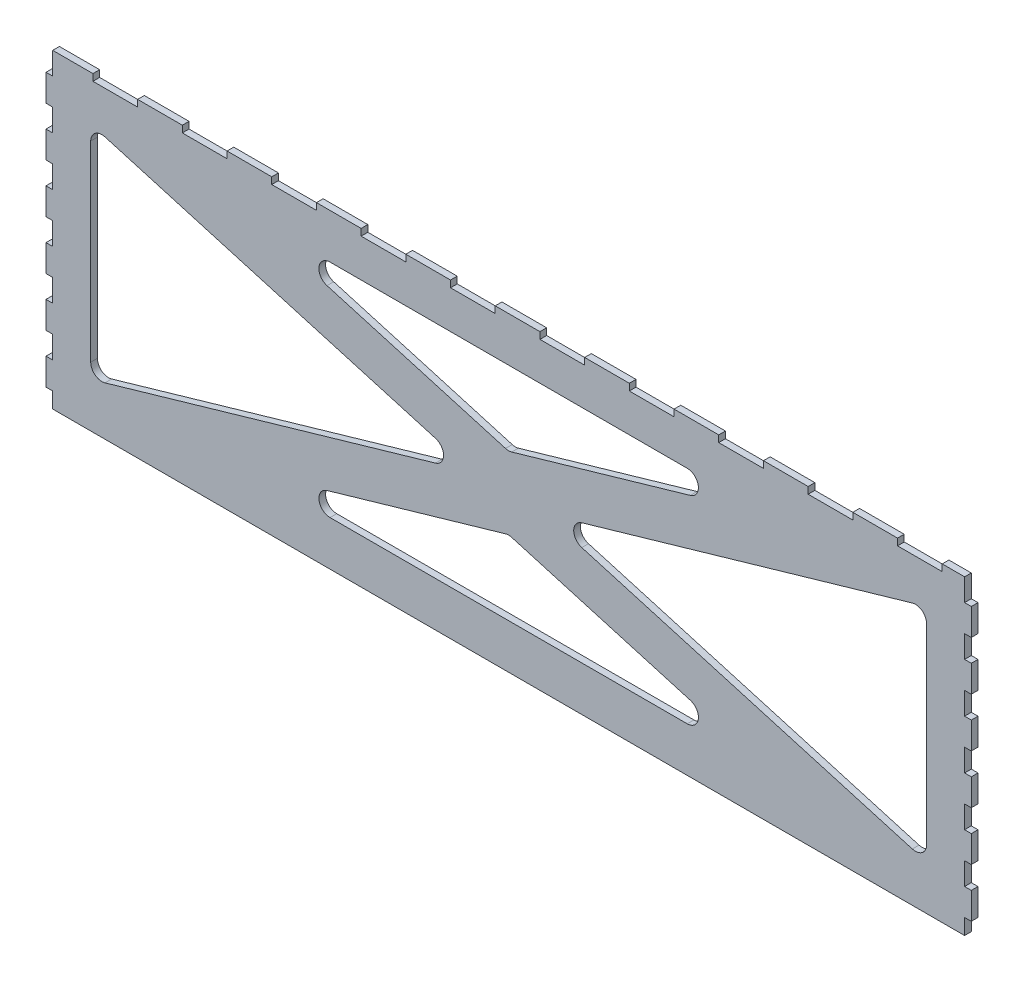
from build123d import *

# Parameters (mm, degrees)
SKETCH1_W           = 414
SKETCH1_H           = 139
BOSS_EXTRUDE1_DEPTH = 3
SKETCH3_W           = 20
SKETCH3_H           = 3
CUT_EXTRUDE2_DEPTH  = 3
SKETCH4_W           = 3
SKETCH4_H           = 12
CUT_EXTRUDE3_DEPTH  = 3


with BuildPart() as part:
    # Sketch1 → Boss-Extrude1 (new body)
    with BuildSketch(Plane.XY.offset(152)):
        Rectangle(SKETCH1_W, SKETCH1_H)
        with BuildLine():
            Line((-187, -42.845788224), (-187, 42.845788224))
            ThreePointArc((-187, 42.845788224), (-185.003590092, 46.843093136), (-180.608621376, 47.648294395))
            Line((-180.608621376, 47.648294395), (-32.721368552, 4.802506171))
            ThreePointArc((-32.721368552, 4.802506171), (-29.112747176, 0), (-32.721368552, -4.802506171))
            Line((-32.721368552, -4.802506171), (-180.608621376, -47.648294395))
            ThreePointArc((-180.608621376, -47.648294395), (-185.003590092, -46.843093136), (-187, -42.845788224))
        make_face(mode=Mode.SUBTRACT)
        with BuildLine():
            Line((79.902960936, 49.5), (-79.902960936, 49.5))
            ThreePointArc((-79.902960936, 49.5), (-84.853341268, 45.202662488), (-81.29433956, 39.697493829))
            Line((-81.29433956, 39.697493829), (-1.391378624, 16.548065617))
            ThreePointArc((-1.391378624, 16.548065617), (0, 16.350571788), (1.391378624, 16.548065617))
            Line((1.391378624, 16.548065617), (81.29433956, 39.697493829))
            ThreePointArc((81.29433956, 39.697493829), (84.853341268, 45.202662488), (79.902960936, 49.5))
        make_face(mode=Mode.SUBTRACT)
        with BuildLine():
            Line((180.608621376, 47.648294395), (32.721368552, 4.802506171))
            ThreePointArc((32.721368552, 4.802506171), (29.112747176, 0), (32.721368552, -4.802506171))
            Line((32.721368552, -4.802506171), (180.608621376, -47.648294395))
            ThreePointArc((180.608621376, -47.648294395), (185.003590092, -46.843093136), (187, -42.845788224))
            Line((187, -42.845788224), (187, 42.845788224))
            ThreePointArc((187, 42.845788224), (185.003590092, 46.843093136), (180.608621376, 47.648294395))
        make_face(mode=Mode.SUBTRACT)
        with BuildLine():
            Line((-81.29433956, -39.697493829), (-1.391378624, -16.548065617))
            ThreePointArc((-1.391378624, -16.548065617), (0, -16.350571788), (1.391378624, -16.548065617))
            Line((1.391378624, -16.548065617), (81.29433956, -39.697493829))
            ThreePointArc((81.29433956, -39.697493829), (84.853341268, -45.202662488), (79.902960936, -49.5))
            Line((79.902960936, -49.5), (-79.902960936, -49.5))
            ThreePointArc((-79.902960936, -49.5), (-84.853341268, -45.202662488), (-81.29433956, -39.697493829))
        make_face(mode=Mode.SUBTRACT)
    extrude(amount=BOSS_EXTRUDE1_DEPTH)

    # Sketch3 → Cut-Extrude2 (cut)
    with BuildSketch(Plane(origin=(0, 0, 152), x_dir=(-1, 0, 0), z_dir=(0, 0, -1))):
        with Locations((-184, 68)):
            Rectangle(SKETCH3_W, SKETCH3_H)
        with Locations((-144, 68)):
            Rectangle(SKETCH3_W, SKETCH3_H)
        with Locations((-104, 68)):
            Rectangle(SKETCH3_W, SKETCH3_H)
        with Locations((-64, 68)):
            Rectangle(SKETCH3_W, SKETCH3_H)
        with Locations((-24, 68)):
            Rectangle(SKETCH3_W, SKETCH3_H)
        with Locations((16, 68)):
            Rectangle(SKETCH3_W, SKETCH3_H)
        with Locations((56, 68)):
            Rectangle(SKETCH3_W, SKETCH3_H)
        with Locations((96, 68)):
            Rectangle(SKETCH3_W, SKETCH3_H)
        with Locations((136, 68)):
            Rectangle(SKETCH3_W, SKETCH3_H)
        with Locations((176, 68)):
            Rectangle(SKETCH3_W, SKETCH3_H)
    extrude(amount=-CUT_EXTRUDE2_DEPTH, mode=Mode.SUBTRACT)

    # Sketch4 → Cut-Extrude3 (cut)
    with BuildSketch(Plane.ZY.offset(207)):
        with BuildLine():
            Line((152, 44), (145.4, 44))
            Line((145.4, 44), (145.4, 47))
            Line((145.4, 47), (140.4, 47))
            Line((140.4, 47), (140.4, 44))
            Line((140.4, 44), (135.4, 44))
            Line((135.4, 44), (135.4, 43.377104502))
            ThreePointArc((135.4, 43.377104502), (139.572199023, -13.668492876), (152, -69.5))
            Line((152, -69.5), (316, -69.5))
            ThreePointArc((316, -69.5), (328.427800977, -13.668492876), (332.6, 43.377104502))
            Line((332.6, 43.377104502), (332.6, 44))
            Line((332.6, 44), (327.6, 44))
            Line((327.6, 44), (327.6, 47))
            Line((327.6, 47), (322.6, 47))
            Line((322.6, 47), (322.6, 44))
            Line((322.6, 44), (316, 44))
            Line((316, 44), (316, 47.5))
            Line((316, 47.5), (313, 47.5))
            Line((313, 47.5), (313, 59.5))
            Line((313, 59.5), (316, 59.5))
            Line((316, 59.5), (316, 69.5))
            Line((316, 69.5), (305, 69.5))
            Line((305, 69.5), (305, 66.5))
            Line((305, 66.5), (295, 66.5))
            Line((295, 66.5), (295, 69.5))
            Line((295, 69.5), (283, 69.5))
            Line((283, 69.5), (283, 66.5))
            Line((283, 66.5), (273, 66.5))
            Line((273, 66.5), (273, 69.5))
            Line((273, 69.5), (261, 69.5))
            Line((261, 69.5), (261, 66.5))
            Line((261, 66.5), (251, 66.5))
            Line((251, 66.5), (251, 69.5))
            Line((251, 69.5), (239, 69.5))
            Line((239, 69.5), (239, 66.5))
            Line((239, 66.5), (229, 66.5))
            Line((229, 66.5), (229, 69.5))
            Line((229, 69.5), (217, 69.5))
            Line((217, 69.5), (217, 66.5))
            Line((217, 66.5), (207, 66.5))
            Line((207, 66.5), (207, 69.5))
            Line((207, 69.5), (195, 69.5))
            Line((195, 69.5), (195, 66.5))
            Line((195, 66.5), (185, 66.5))
            Line((185, 66.5), (185, 69.5))
            Line((185, 69.5), (173, 69.5))
            Line((173, 69.5), (173, 66.5))
            Line((173, 66.5), (163, 66.5))
            Line((163, 66.5), (163, 69.5))
            Line((163, 69.5), (152, 69.5))
            Line((152, 69.5), (152, 59.5))
            Line((152, 59.5), (155, 59.5))
            Line((155, 59.5), (155, 47.5))
            Line((155, 47.5), (152, 47.5))
            Line((152, 47.5), (152, 44))
        make_face()
        with Locations((153.5, 31.5)):
            Rectangle(SKETCH4_W, SKETCH4_H, mode=Mode.SUBTRACT)
        with Locations((314.5, 31.5)):
            Rectangle(SKETCH4_W, SKETCH4_H, mode=Mode.SUBTRACT)
        with Locations((153.5, -56.5)):
            Rectangle(SKETCH4_W, SKETCH4_H, mode=Mode.SUBTRACT)
        with Locations((314.5, 9.5)):
            Rectangle(SKETCH4_W, SKETCH4_H, mode=Mode.SUBTRACT)
        with Locations((314.5, -12.5)):
            Rectangle(SKETCH4_W, SKETCH4_H, mode=Mode.SUBTRACT)
        with Locations((314.5, -34.5)):
            Rectangle(SKETCH4_W, SKETCH4_H, mode=Mode.SUBTRACT)
        with Locations((314.5, -56.5)):
            Rectangle(SKETCH4_W, SKETCH4_H, mode=Mode.SUBTRACT)
        with Locations((153.5, 9.5)):
            Rectangle(SKETCH4_W, SKETCH4_H, mode=Mode.SUBTRACT)
        with Locations((153.5, -12.5)):
            Rectangle(SKETCH4_W, SKETCH4_H, mode=Mode.SUBTRACT)
        with Locations((153.5, -34.5)):
            Rectangle(SKETCH4_W, SKETCH4_H, mode=Mode.SUBTRACT)
    cut_extrude3 = extrude(amount=-CUT_EXTRUDE3_DEPTH, mode=Mode.SUBTRACT)

    # Mirror1: Cut-Extrude3 across plane
    add(cut_extrude3.mirror(Plane(origin=(0, 0, 0), x_dir=(0, 0, 1), z_dir=(1, 0, 0))), mode=Mode.SUBTRACT)


solid = part.part
